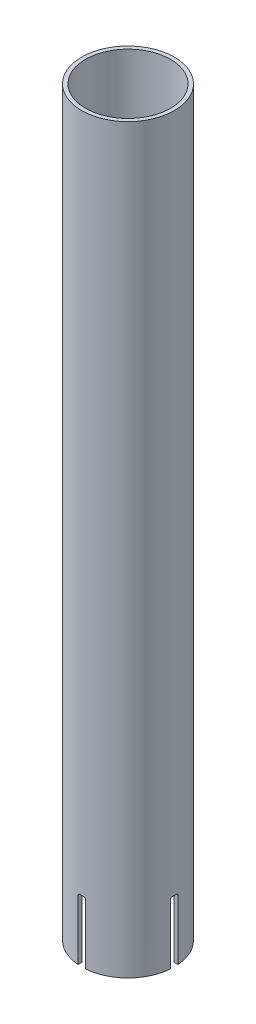
from build123d import *

# Parameters (mm, degrees)
SKETCH1_W                = 1.5875
SKETCH1_H                = 304.8
SKETCH2_ONE_SIDE_W       = 17.4625
SKETCH2_ONE_SIDE_H       = 6.35
SKETCH3_W                = 3.175
SKETCH3_H                = 25.4
CUT_EXTRUDE2_DEPTH       = 50.8
FILLET1_R                = 0.79375
CIRPATTERN1_COUNT        = 4
FILLET1_OF_CIRPATTERN1_R = 0.79375


with BuildPart() as part:
    # Sketch1 → Revolve2 (revolve)
    with BuildSketch(Plane.XY):
        with Locations((-18.25625, 152.4)):
            Rectangle(SKETCH1_W, SKETCH1_H)
    revolve(axis=Axis((0, 0, 0), (0, 1, 0)))

    # Sketch3 → Cut-Extrude2 (cut)
    with BuildSketch(Plane.XY):
        with Locations((0, 12.7)):
            Rectangle(SKETCH3_W, SKETCH3_H)
    cut_extrude2 = extrude(amount=-CUT_EXTRUDE2_DEPTH, mode=Mode.SUBTRACT)

    # Fillet1
    fillet1_edges = [part.edges().sort_by_distance(p)[0] for p in [
        (-1.5875, 25.4, -18.186965065),
        (1.5875, 25.4, -18.186965065),
    ]]
    fillet(fillet1_edges, radius=FILLET1_R)

    # CirPattern1: Cut-Extrude2 ×4 about axis
    cirpattern1_axis = Axis((0, 0, 0), (0, -1, 0))
    for i in range(1, CIRPATTERN1_COUNT):
        add(cut_extrude2.rotate(cirpattern1_axis, i * 360 / CIRPATTERN1_COUNT), mode=Mode.SUBTRACT)

    # Fillet1 of CirPattern1
    fillet1_of_cirpattern1_edges = [part.edges().sort_by_distance(p)[0] for p in [
        (18.186965065, 25.4, -1.5875),
        (18.186965065, 25.4, 1.5875),
        (1.5875, 25.4, 18.186965065),
        (-1.5875, 25.4, 18.186965065),
        (-18.186965065, 25.4, 1.5875),
        (-18.186965065, 25.4, -1.5875),
    ]]
    fillet(fillet1_of_cirpattern1_edges, radius=FILLET1_OF_CIRPATTERN1_R)


with BuildPart() as body_2:
    # Sketch2 one side → Revolve4 (revolve)
    with BuildSketch(Plane.XY):
        with Locations((-8.73125, 250.825)):
            Rectangle(SKETCH2_ONE_SIDE_W, SKETCH2_ONE_SIDE_H)
    revolve(axis=Axis((0, 0, 0), (0, 1, 0)))


solid = Compound([part.part, body_2.part])
